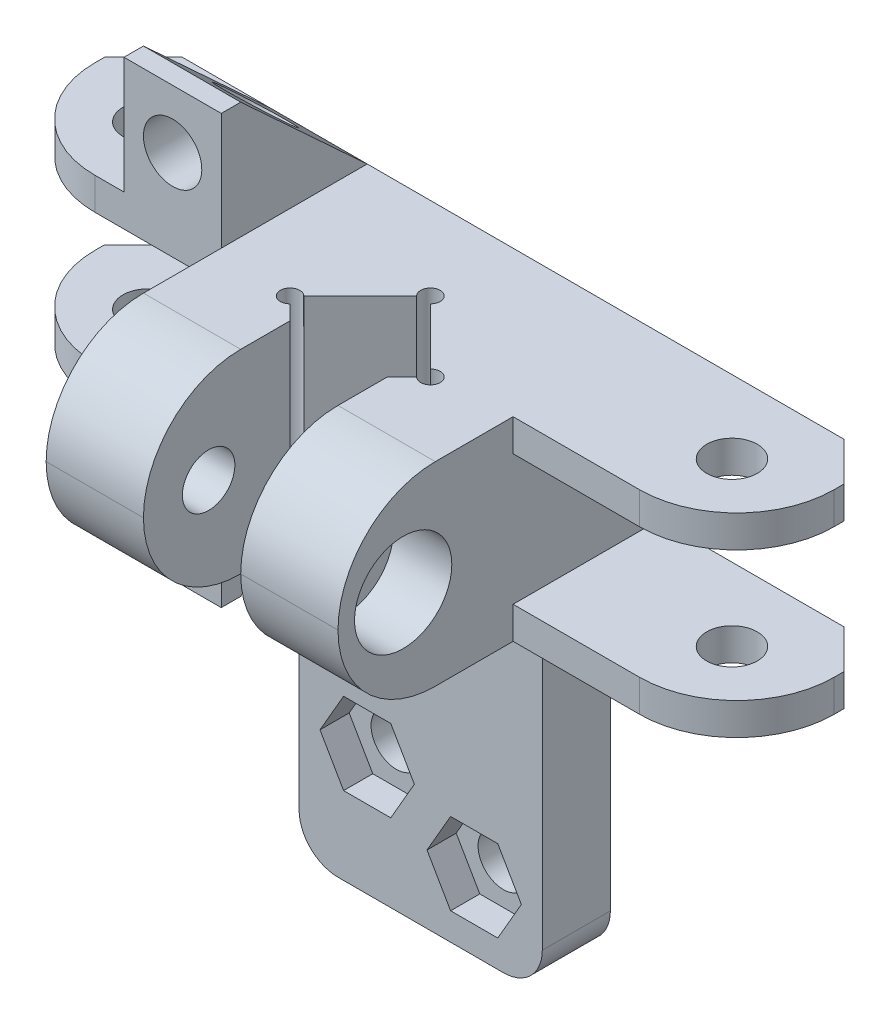
from build123d import *

# Parameters (mm, degrees)
SKIZZE2_R                            = 2.6
AUFSATZ_LINEAR_AUSTRAGEN1_DEPTH      = 10
SCHNITT_LINEAR_AUSTRAGEN1_DEPTH      = 44.890751019
SCHNITT_LINEAR_AUSTRAGEN1_DEPTH_BACK = 44.890751019
SKIZZE3_R                            = 1
SKIZZE3_W                            = 10
SKIZZE3_H                            = 22.630927951
SKIZZE4_W                            = 30
SKIZZE4_H                            = 13.4
SCHNITT_LINEAR_AUSTRAGEN2_DEPTH      = 44.890751019
SCHNITT_LINEAR_AUSTRAGEN3_DEPTH      = 44.890751019
SCHNITT_LINEAR_AUSTRAGEN3_DEPTH_BACK = 44.890751019
SKIZZE5_R                            = 2.7
SCHNITT_LINEAR_START                 = 15
SKIZZE6_R                            = 5
SCHNITT_LINEAR_AUSTRAGEN4_DEPTH      = 6
SCHNITT_LINEAR_START_2               = -15
SCHNITT_LINEAR_AUSTRAGEN5_DEPTH      = 6
AUFSATZ_LINEAR_START                 = -15
AUFSATZ_LINEAR_AUSTRAGEN2_DEPTH      = 10
SKIZZE10_R                           = 3
SCHNITT_LINEAR_AUSTRAGEN6_DEPTH      = 49.06659989
FASE1_SIZE                           = 4
VERRUNDUNG1_R                        = 10
VERRUNDUNG2_R                        = 10
SKIZZE11_R                           = 2.6
AUFSATZ_LINEAR_AUSTRAGEN3_DEPTH      = 7
VERRUNDUNG3_R                        = 4
SCHNITT_LINEAR_AUSTRAGEN7_DEPTH      = 3


with BuildPart() as part:
    # Skizze2 → Aufsatz-Linear austragen1 (new, symmetric)
    with BuildSketch(Plane(origin=(0, 0, 0), x_dir=(1, 0, 0), z_dir=(0, 1, 0))):
        Polygon((38, 13.445), (-38, 13.445), (-38, -1.555), (-15, -1.555), (-15, -19.555), (15, -19.555), (15, -1.555), (38, -1.555), align=None)
        with Locations(Location((-30, 5.945, 0), (0, 0, 270))):
            Circle(SKIZZE2_R, mode=Mode.SUBTRACT)
        with Locations(Location((30, 5.945, 0), (0, 0, 270))):
            Circle(SKIZZE2_R, mode=Mode.SUBTRACT)
        Polygon((0, -9.479978336), (7.212489168, -2.267489168), (0, 4.945), (-7.212489168, -2.267489168), align=None, mode=Mode.SUBTRACT)
    extrude(amount=AUFSATZ_LINEAR_AUSTRAGEN1_DEPTH, both=True)

    # Skizze3 → Schnitt-Linear austragen1 (cut, two sides: drawn at the far end of the back side and taken through both)
    with BuildSketch(Plane(origin=(0, 0, 0), x_dir=(1, 0, 0), z_dir=(0, 1, 0)).offset(-SCHNITT_LINEAR_AUSTRAGEN1_DEPTH_BACK)):
        with Locations((0, 4.945)):
            Circle(SKIZZE3_R)
        with Locations((-7.212489168, -2.267489168)):
            Circle(SKIZZE3_R)
        with Locations((7.212489168, -2.267489168)):
            Circle(SKIZZE3_R)
        with Locations((0, -15.795442312)):
            Rectangle(SKIZZE3_W, SKIZZE3_H)
    extrude(amount=SCHNITT_LINEAR_AUSTRAGEN1_DEPTH + SCHNITT_LINEAR_AUSTRAGEN1_DEPTH_BACK, mode=Mode.SUBTRACT)

    # Skizze4 → Schnitt-Linear austragen2 (cut, symmetric)
    with BuildSketch(Plane.XY):
        with Locations((30, 0)):
            Rectangle(SKIZZE4_W, SKIZZE4_H)
    schnitt_linear_austragen2 = extrude(amount=SCHNITT_LINEAR_AUSTRAGEN2_DEPTH, both=True, mode=Mode.SUBTRACT)

    # Spiegeln1: Schnitt-Linear austragen2 across plane
    add(schnitt_linear_austragen2.mirror(Plane(origin=(0, 0, 0), x_dir=(0, 0, 1), z_dir=(1, 0, 0))), mode=Mode.SUBTRACT)

    # Skizze5 → Schnitt-Linear austragen3 (cut, two sides: drawn at the far end of the back side and taken through both)
    with BuildSketch(Plane(origin=(0, 0, 0), x_dir=(0, 0, -1), z_dir=(1, 0, 0)).offset(-SCHNITT_LINEAR_AUSTRAGEN3_DEPTH_BACK)):
        with Locations((-12.855, 0)):
            Circle(SKIZZE5_R)
    extrude(amount=SCHNITT_LINEAR_AUSTRAGEN3_DEPTH + SCHNITT_LINEAR_AUSTRAGEN3_DEPTH_BACK, mode=Mode.SUBTRACT)

    # Skizze6 → Schnitt-Linear austragen4 (cut)
    with BuildSketch(Plane(origin=(0, 0, 0), x_dir=(0, 0, -1), z_dir=(1, 0, 0)).offset(SCHNITT_LINEAR_START)):
        with Locations((-12.855, 0)):
            Circle(SKIZZE6_R)
    extrude(amount=-SCHNITT_LINEAR_AUSTRAGEN4_DEPTH, mode=Mode.SUBTRACT)

    # Skizze7 → Schnitt-Linear austragen5 (cut)
    with BuildSketch(Plane(origin=(0, 0, 0), x_dir=(0, 0, -1), z_dir=(1, 0, 0)).offset(SCHNITT_LINEAR_START_2)):
        Polygon((-15.279871131, 4.2), (-17.704742261, 0), (-15.279871131, -4.2), (-10.430128869, -4.2), (-8.005257739, 0), (-10.430128869, 4.2), align=None)
    extrude(amount=SCHNITT_LINEAR_AUSTRAGEN5_DEPTH, mode=Mode.SUBTRACT)

    # Skizze9 → Aufsatz-Linear austragen2 (add)
    with BuildSketch(Plane(origin=(0, 0, 0), x_dir=(0, 0, -1), z_dir=(1, 0, 0)).offset(AUFSATZ_LINEAR_START)):
        Polygon((-1.555, -10), (13.445, -10), (0.445, -22), (-1.555, -22), align=None)
    aufsatz_linear_austragen2 = extrude(amount=-AUFSATZ_LINEAR_AUSTRAGEN2_DEPTH)

    # Spiegeln2: Aufsatz-Linear austragen2 across plane
    add(aufsatz_linear_austragen2.mirror(Plane.ZX))

    # Skizze10 → Schnitt-Linear austragen6 (cut, symmetric)
    with BuildSketch(Plane.XY):
        with Locations(Location((-20, -16, 0), (0, 0, 270))):
            Circle(SKIZZE10_R)
    schnitt_linear_austragen6 = extrude(amount=SCHNITT_LINEAR_AUSTRAGEN6_DEPTH, both=True, mode=Mode.SUBTRACT)

    # Spiegeln3: Schnitt-Linear austragen6 across plane
    add(schnitt_linear_austragen6.mirror(Plane.ZX), mode=Mode.SUBTRACT)

    # Fase1
    fase1_edges = [part.edges().sort_by_distance(p)[0] for p in [
        (-38, 8.35, -13.445),
        (-38, -8.35, -13.445),
        (38, 8.35, -13.445),
        (38, -8.35, -13.445),
    ]]
    chamfer(fase1_edges, length=FASE1_SIZE)

    # Verrundung1
    verrundung1_edges = [part.edges().sort_by_distance(p)[0] for p in [
        (38, 8.35, 1.555),
        (38, -8.35, 1.555),
        (-38, -8.35, 1.555),
        (-38, 8.35, 1.555),
    ]]
    fillet(verrundung1_edges, radius=VERRUNDUNG1_R)

    # Verrundung2
    verrundung2_edges = [part.edges().sort_by_distance(p)[0] for p in [
        (10, -10, 19.555),
        (-10, -10, 19.555),
        (-10, 10, 19.555),
        (10, 10, 19.555),
    ]]
    fillet(verrundung2_edges, radius=VERRUNDUNG2_R - 0.0001)  # a hair under: the kernel refuses the full size

    # Skizze11 → Aufsatz-Linear austragen3 (add)
    with BuildSketch(Plane(origin=(0, 0, -13.445), x_dir=(-1, 0, 0), z_dir=(0, 0, -1))):
        Polygon((10, -10), (15, -10), (15, -48), (-10, -48), (-10, -10), align=None)
        with Locations((-3, -41)):
            Circle(SKIZZE11_R, mode=Mode.SUBTRACT)
        with Locations((8, -35.8)):
            Circle(SKIZZE11_R, mode=Mode.SUBTRACT)
    extrude(amount=-AUFSATZ_LINEAR_AUSTRAGEN3_DEPTH)

    # Verrundung3
    verrundung3_edges = [part.edges().sort_by_distance(p)[0] for p in [
        (10, -48, -9.945),
        (-15, -48, -9.945),
    ]]
    fillet(verrundung3_edges, radius=VERRUNDUNG3_R)

    # Skizze12 → Schnitt-Linear austragen7 (cut)
    with BuildSketch(Plane.XY.offset(-6.445)):
        Polygon((5.424871131, -36.8), (0.575128869, -36.8), (-1.849742261, -41), (0.575128869, -45.2), (5.424871131, -45.2), (7.849742261, -41), align=None)
        Polygon((-10.424871131, -40), (-5.575128869, -40), (-3.150257739, -35.8), (-5.575128869, -31.6), (-10.424871131, -31.6), (-12.849742261, -35.8), align=None)
    extrude(amount=-SCHNITT_LINEAR_AUSTRAGEN7_DEPTH, mode=Mode.SUBTRACT)


solid = part.part
